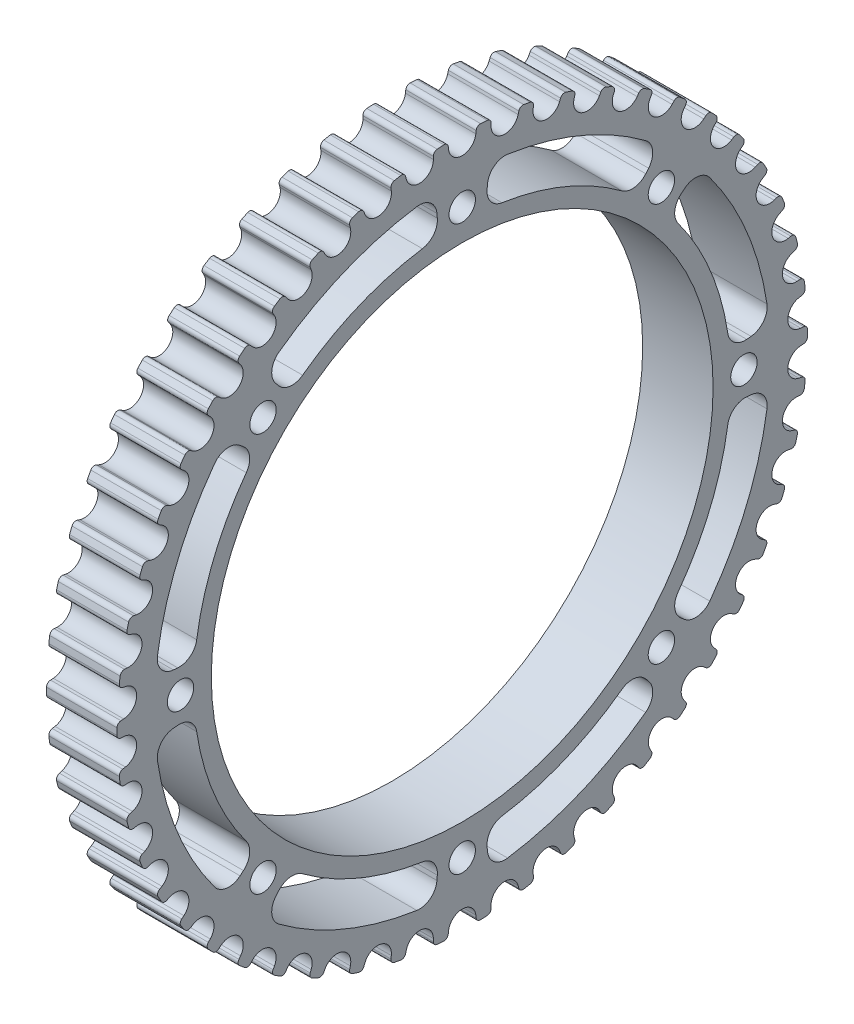
from build123d import *

# Parameters (mm, degrees)
CHAMFER_1_SIZE           = 1
SKETCH_4_W               = 5
SKETCH_4_H               = 2.299999953
CUT_EXTRUDE_1_DEPTH      = 135.926287581
FILLET_1_R               = 2
FILLET_2_R               = 2.5
SKETCH_5_R               = 4.70616
CUT_EXTRUDE_2_DEPTH      = 135.926287581
PATTERN_CIRCULAR_1_COUNT = 4
CUT_EXTRUDE_3_REACH      = 136.926
PATTERN_CIRCULAR_3_COUNT = 50
SKETCH_7_R               = 43.908876909
CUT_EXTRUDE_4_DEPTH      = 53
SKETCH_8_R               = 46.078779584
CUT_EXTRUDE_6_DEPTH      = 62
EXTRUDE_START            = -8
SKETCH_9_R               = 4.70616
EXTRUDE_1_DEPTH          = 8
SKETCH_10_R              = 45
EXTRUDE_2_DEPTH          = 2
SKETCH_11_R              = 1.5
CUT_EXTRUDE_7_DEPTH      = 10
SKETCH_12_R              = 28.5
CUT_EXTRUDE_8_DEPTH      = 10
EXTRUDE_3_DEPTH          = 4
FILLET_3_R               = 2
EXTRUDE_4_DEPTH          = 9
SKETCH_16_R              = 1.25
CUT_EXTRUDE_9_DEPTH      = 41
CUT_EXTRUDE_10_DEPTH     = 8
FILLET_4_R               = 2
SKETCH_19_W              = 50.406857466
SKETCH_19_H              = 5.280555803
SKETCH_19_H_2            = 6.899243611
SKETCH_19_W_2            = 7.452936757
SKETCH_19_H_3            = 46.072699952
CUT_EXTRUDE_11_DEPTH     = 10
CUT_EXTRUDE_START        = -2
SKETCH_18_R              = 28.5
SKETCH_18_R_2            = 18.5
CUT_EXTRUDE_2_2_DEPTH    = 2
FILLET_START             = 50
FILLET_5_DEPTH           = 10
FILLET_START_2           = 51
FILLET_5_2_DEPTH         = 10
EXTRUDE_START_2          = -2
EXTRUDE_5_OUTLINE_R      = 1.5
EXTRUDE_5_DEPTH          = 5
FILLET_6_R               = 2
EXTRUDE_6_DEPTH          = 1
SKETCH_22_R              = 59.368046871
CUT_EXTRUDE_12_DEPTH     = 12


with BuildPart() as part:
    # 草图1 → 旋转1 (revolve)
    with BuildSketch(Plane.XY, mode=Mode.PRIVATE) as revolve_1_sk:
        with BuildLine():
            Line((0, 7.8436), (0, 15.6872))
            Line((0, 15.6872), (44, 17.446730772))
            Line((44, 17.446730772), (44, 29.614869228))
            Line((44, 29.614869228), (0, 31.3744))
            Line((0, 31.3744), (0, 39.018))
            ThreePointArc((0, 39.018), (0.058578644, 39.159421356), (0.2, 39.218))
            Line((0.2, 39.218), (122.8, 39.218))
            ThreePointArc((122.8, 39.218), (122.941421356, 39.159421356), (123, 39.018))
            Line((123, 39.018), (123, 31.3744))
            Line((123, 31.3744), (79, 29.614869228))
            Line((79, 29.614869228), (79, 17.446730772))
            Line((79, 17.446730772), (123, 15.6872))
            Line((123, 15.6872), (123, 7.8436))
            Line((123, 7.8436), (0, 7.8436))
        make_face()
    revolve(revolve_1_sk.sketch.rotate(Axis((0, 0, 0), (1, 0, 0)), 90), axis=Axis((0, 0, 0), (1, 0, 0)))

    # 倒角1
    chamfer_1_edges = [part.edges().sort_by_distance(p)[0] for p in [
        (0, 0, -7.8436),
        (123, 0, -7.8436),
    ]]
    chamfer(chamfer_1_edges, length=CHAMFER_1_SIZE)

    # 草图4 → 切除-拉伸1 (cut, through all)
    with BuildSketch(Plane.ZY):
        with Locations((0, 8.584518183)):
            Rectangle(SKETCH_4_W, SKETCH_4_H)
    extrude(amount=-CUT_EXTRUDE_1_DEPTH, mode=Mode.SUBTRACT)

    # 圆角1
    fillet_1_edges = [part.edges().sort_by_distance(p)[0] for p in [
        (79, 0, -17.446730772),
        (79, 0, -29.614869228),
        (44, 0, -29.614869228),
        (44, 0, -17.446730772),
    ]]
    fillet(fillet_1_edges, radius=FILLET_1_R)

    # 圆角2
    fillet_2_edges = [part.edges().sort_by_distance(p)[0] for p in [
        (0, 0, -15.6872),
        (123, 0, -15.6872),
    ]]
    fillet(fillet_2_edges, radius=FILLET_2_R)

    # 草图5 → Cut-Extrude 2 (cut, through all)
    with BuildSketch(Plane(origin=(0, 0, 0), x_dir=(0, 0, -1), z_dir=(1, 0, 0))):
        with Locations(Location((0, 23.5308, 0), (0, 0, 120.379266324))):
            Circle(SKETCH_5_R)
    cut_extrude_2 = extrude(amount=CUT_EXTRUDE_2_DEPTH, mode=Mode.SUBTRACT)

    # 阵列(圆周)1: Cut-Extrude 2 ×4 about axis
    pattern_circular_1_axis = Axis((0, 0, 0), (1, 0, 0))
    for i in range(1, PATTERN_CIRCULAR_1_COUNT):
        add(cut_extrude_2.rotate(pattern_circular_1_axis, i * 360 / PATTERN_CIRCULAR_1_COUNT), mode=Mode.SUBTRACT)

    # 草图6 → 切除-拉伸3 (cut, up to next)
    with BuildSketch(Plane(origin=(0, 0, 0), x_dir=(0, 0, -1), z_dir=(1, 0, 0)), mode=Mode.PRIVATE) as cut_extrude_3_sk1:
        with BuildLine():
            Line((-1.586880376, 38.741509405), (-1.548371997, 38.427883824))
            ThreePointArc((-1.548371997, 38.427883824), (0, 37.058), (1.548371997, 38.427883824))
            Line((1.548371997, 38.427883824), (1.586880376, 38.741509405))
            ThreePointArc((1.586880376, 38.741509405), (1.754935187, 39.050856629), (2.088868774, 39.162330769))
            ThreePointArc((2.088868774, 39.162330769), (2.328487489, 39.148814414), (2.568019002, 39.133831941))
            Line((2.568019002, 39.133831941), (7.01809158, 75.376764653))
            ThreePointArc((7.01809158, 75.376764653), (0, 75.702775768), (-7.01809158, 75.376764653))
            Line((-7.01809158, 75.376764653), (-2.568019002, 39.133831941))
            ThreePointArc((-2.568019002, 39.133831941), (-2.328487489, 39.148814414), (-2.088868774, 39.162330769))
            ThreePointArc((-2.088868774, 39.162330769), (-1.754935187, 39.050856629), (-1.586880376, 38.741509405))
        make_face()
    cut_extrude_3_tool1 = extrude(cut_extrude_3_sk1.sketch, amount=CUT_EXTRUDE_3_REACH, mode=Mode.PRIVATE) & part.part
    cut_extrude_3 = cut_extrude_3_tool1.solids().sort_by_distance((0, 59.854012, 0))[0]
    add(cut_extrude_3, mode=Mode.SUBTRACT)

    # 阵列(圆周)3: 切除-拉伸3 ×50 about axis
    pattern_circular_3_axis = Axis((0, 0, 0), (1, 0, 0))
    for i in range(1, PATTERN_CIRCULAR_3_COUNT):
        add(cut_extrude_3.rotate(pattern_circular_3_axis, i * 360 / PATTERN_CIRCULAR_3_COUNT), mode=Mode.SUBTRACT)

    # 草图7 → 切除-拉伸4 (cut)
    with BuildSketch(Plane(origin=(123, 0, 0), x_dir=(0, 0, -1), z_dir=(1, 0, 0))):
        Circle(SKETCH_7_R)
    extrude(amount=-CUT_EXTRUDE_4_DEPTH, mode=Mode.SUBTRACT)

    # 草图8 → 切除-拉伸6 (cut)
    with BuildSketch(Plane.ZY):
        Circle(SKETCH_8_R)
    extrude(amount=-CUT_EXTRUDE_6_DEPTH, mode=Mode.SUBTRACT)

    # 草图9 → 凸台-拉伸1 (add)
    with BuildSketch(Plane(origin=(70, 0, 0), x_dir=(0, 0, -1), z_dir=(1, 0, 0)).offset(EXTRUDE_START)):
        with Locations((23.5308, 0)):
            Circle(SKETCH_9_R)
        with Locations((0, -23.5308)):
            Circle(SKETCH_9_R)
        with Locations((-23.5308, 0)):
            Circle(SKETCH_9_R)
        with Locations((0, 23.5308)):
            Circle(SKETCH_9_R)
        with BuildLine():
            Line((-2.5, 9.734518159), (-2.5, 7.434518206))
            ThreePointArc((-2.5, 7.434518206), (0, -7.8436), (2.5, 7.434518206))
            Line((2.5, 7.434518206), (2.5, 9.734518159))
            Line((2.5, 9.734518159), (-2.5, 9.734518159))
        make_face()
    extrude(amount=EXTRUDE_1_DEPTH)

    # 草图10 → 凸台-拉伸2 (add)
    with BuildSketch(Plane.ZY.offset(-62)):
        Circle(SKETCH_10_R)
    extrude(amount=EXTRUDE_2_DEPTH)

    # 草图11 → 切除-拉伸7 (cut)
    with BuildSketch(Plane.ZY.offset(-60)):
        with Locations((0, 32)):
            Circle(SKETCH_11_R)
        with Locations((22.627416998, 22.627416998)):
            Circle(SKETCH_11_R)
        with Locations((32, 0)):
            Circle(SKETCH_11_R)
        with Locations((22.627416998, -22.627416998)):
            Circle(SKETCH_11_R)
        with Locations((0, -32)):
            Circle(SKETCH_11_R)
        with Locations((-22.627416998, -22.627416998)):
            Circle(SKETCH_11_R)
        with Locations((-32, 0)):
            Circle(SKETCH_11_R)
        with Locations((-22.627416998, 22.627416998)):
            Circle(SKETCH_11_R)
    extrude(amount=-CUT_EXTRUDE_7_DEPTH, mode=Mode.SUBTRACT)

    # 草图12 → 切除-拉伸8 (cut)
    with BuildSketch(Plane.ZY.offset(-60)):
        Circle(SKETCH_12_R)
    extrude(amount=-CUT_EXTRUDE_8_DEPTH, mode=Mode.SUBTRACT)


with BuildPart() as body_2:
    # Split Bodies 1: read off the stored shape, not the designer's step
    # Split Bodies 1: the piece on the far side of the plane
    add(part.part)
    split(bisect_by=Plane.YZ.offset(62), keep=Keep.BOTTOM)

    # 草图13 → 凸台-拉伸3 (add)
    with BuildSketch(Plane.ZY.offset(-60)):
        with BuildLine():
            ThreePointArc((-5, 28.057975693), (-20.152543264, 20.152543264), (-28.057975693, 5))
            Line((-28.057975693, 5), (-19.364916731, 5))
            ThreePointArc((-19.364916731, 5), (-14.142135624, 14.142135624), (-5, 19.364916731))
            Line((-5, 19.364916731), (-5, 28.057975693))
        make_face()
        with BuildLine():
            Line((19.364916731, 5), (28.057975693, 5))
            ThreePointArc((28.057975693, 5), (20.152543264, 20.152543264), (5, 28.057975693))
            Line((5, 28.057975693), (5, 19.364916731))
            ThreePointArc((5, 19.364916731), (14.142135624, 14.142135624), (19.364916731, 5))
        make_face()
        with BuildLine():
            Line((5, -19.364916731), (5, -28.057975693))
            ThreePointArc((5, -28.057975693), (20.152543264, -20.152543264), (28.057975693, -5))
            Line((28.057975693, -5), (19.364916731, -5))
            ThreePointArc((19.364916731, -5), (14.142135624, -14.142135624), (5, -19.364916731))
        make_face()
        with BuildLine():
            ThreePointArc((-28.057975693, -5), (-20.152543264, -20.152543264), (-5, -28.057975693))
            Line((-5, -28.057975693), (-5, -19.364916731))
            ThreePointArc((-5, -19.364916731), (-14.142135624, -14.142135624), (-19.364916731, -5))
            Line((-19.364916731, -5), (-28.057975693, -5))
        make_face()
    extrude(amount=-EXTRUDE_3_DEPTH)

    # 圆角3
    fillet_3_edges = [body_2.edges().sort_by_distance(p)[0] for p in [
        (61, 28.057975693, -5),
        (61, 5, -28.057975693),
        (62, 19.364916731, -5),
        (62, 5, -19.364916731),
        (61, 5, 28.057975693),
        (61, 28.057975693, 5),
        (62, 5, 19.364916731),
        (62, 19.364916731, 5),
        (61, -28.057975693, 5),
        (61, -5, 28.057975693),
        (62, -19.364916731, 5),
        (62, -5, 19.364916731),
        (61, -28.057975693, -5),
        (62, -5, -19.364916731),
        (62, -19.364916731, -5),
        (61, -5, -28.057975693),
    ]]
    fillet(fillet_3_edges, radius=FILLET_3_R)

    # 草图15 → 凸台-拉伸4 (add)
    with BuildSketch(Plane.ZY.offset(-60)):
        Polygon((-12, 28), (-12, 16), (-8, 16), (-8, 28), (-8, 38), (8, 38), (8, 28), (8, 16), (12, 16), (12, 28), (12, 38), (12, 40), (-12, 40), (-12, 38), align=None)
        Polygon((-12, -28), (-12, -38), (-12, -40), (12, -40), (12, -38), (12, -28), (12, -16), (8, -16), (8, -28), (8, -38), (-8, -38), (-8, -28), (-8, -16), (-12, -16), align=None)
    extrude(amount=EXTRUDE_4_DEPTH)

    # 草图16 → 切除-拉伸9 (cut)
    with BuildSketch(Plane(origin=(0, 0, -12), x_dir=(-1, 0, 0), z_dir=(0, 0, -1))):
        with Locations((-54, 18.5)):
            Circle(SKETCH_16_R)
        with Locations((-54, 24.5)):
            Circle(SKETCH_16_R)
        with Locations((-54, -24.5)):
            Circle(SKETCH_16_R)
        with Locations((-54, -18.5)):
            Circle(SKETCH_16_R)
    extrude(amount=-CUT_EXTRUDE_9_DEPTH, mode=Mode.SUBTRACT)

    # 草图19 → 切除-拉伸11 (cut)
    with BuildSketch(Plane.ZY.offset(-60)):
        with Locations((0.464203518, 42.640277901)):
            Rectangle(SKETCH_19_W, SKETCH_19_H)
        with Locations((0.464203518, -43.449621806)):
            Rectangle(SKETCH_19_W, SKETCH_19_H_2)
        with Locations((-43.726468379, -0.85654393)):
            Rectangle(SKETCH_19_W_2, SKETCH_19_H_3)
        with Locations((43.726468379, -0.85654393)):
            Rectangle(SKETCH_19_W_2, SKETCH_19_H_3)
    extrude(amount=-CUT_EXTRUDE_11_DEPTH, mode=Mode.SUBTRACT)

    # 草图18 → Cut-Extrude 2 2 (cut)
    with BuildSketch(Plane(origin=(64, 0, 0), x_dir=(0, 0, -1), z_dir=(1, 0, 0)).offset(CUT_EXTRUDE_START)):
        Circle(SKETCH_18_R)
        Circle(SKETCH_18_R_2, mode=Mode.SUBTRACT)
    extrude(amount=CUT_EXTRUDE_2_2_DEPTH, mode=Mode.SUBTRACT)

    # 圆角5: read off the stored shape, not the designer's step
    # 圆角5 outline → 圆角5 (cut)
    with BuildSketch(Plane.YZ.offset(FILLET_START)):
        with BuildLine():
            Line((-16, -12), (-16, -11))
            ThreePointArc((-16, -11), (-16.292893219, -11.707106781), (-17, -12))
            Line((-17, -12), (-16, -12))
        make_face()
        with BuildLine():
            Line((-16, -8), (-17, -8))
            ThreePointArc((-17, -8), (-16.292893219, -8.292893219), (-16, -9))
            Line((-16, -9), (-16, -8))
        make_face()
        with BuildLine():
            ThreePointArc((-17, 12), (-16.292893219, 11.707106781), (-16, 11))
            Line((-16, 11), (-16, 12))
            Line((-16, 12), (-17, 12))
        make_face()
        with BuildLine():
            ThreePointArc((-16, 9), (-16.292893219, 8.292893219), (-17, 8))
            Line((-17, 8), (-16, 8))
            Line((-16, 8), (-16, 9))
        make_face()
        with BuildLine():
            ThreePointArc((17, -12), (16.292893219, -11.707106781), (16, -11))
            Line((16, -11), (16, -12))
            Line((16, -12), (17, -12))
        make_face()
        with BuildLine():
            ThreePointArc((16, -9), (16.292893219, -8.292893219), (17, -8))
            Line((17, -8), (16, -8))
            Line((16, -8), (16, -9))
        make_face()
        with BuildLine():
            ThreePointArc((17, 8), (16.292893219, 8.292893219), (16, 9))
            Line((16, 9), (16, 8))
            Line((16, 8), (17, 8))
        make_face()
        with BuildLine():
            ThreePointArc((16, 11), (16.292893219, 11.707106781), (17, 12))
            Line((17, 12), (16, 12))
            Line((16, 12), (16, 11))
        make_face()
    extrude(amount=FILLET_5_DEPTH, mode=Mode.SUBTRACT)

    # Fillet 5 2 outline → Fillet 5 2 (add)
    with BuildSketch(Plane.YZ.offset(FILLET_START_2)):
        with BuildLine():
            Line((-38, 8), (-38, 7))
            ThreePointArc((-38, 7), (-37.707106781, 7.707106781), (-37, 8))
            Line((-37, 8), (-38, 8))
        make_face()
        with BuildLine():
            ThreePointArc((-37, -8), (-37.707106781, -7.707106781), (-38, -7))
            Line((-38, -7), (-38, -8))
            Line((-38, -8), (-37, -8))
        make_face()
        with BuildLine():
            Line((38, -8), (38, -7))
            ThreePointArc((38, -7), (37.707106781, -7.707106781), (37, -8))
            Line((37, -8), (38, -8))
        make_face()
        with BuildLine():
            Line((38, 8), (37, 8))
            ThreePointArc((37, 8), (37.707106781, 7.707106781), (38, 7))
            Line((38, 7), (38, 8))
        make_face()
    extrude(amount=FILLET_5_2_DEPTH)

    # 凸台-拉伸5: read off the stored shape, not the designer's step
    # 凸台-拉伸5 outline → 凸台-拉伸5 (add)
    # profile 1 of 2: a face of its own
    with BuildSketch(Plane.ZY.offset(-60).offset(EXTRUDE_START_2)):
        with BuildLine():
            ThreePointArc((-8, 18.33030278), (0, 20), (8, 18.33030278))
            Line((8, 18.33030278), (8, 37))
            ThreePointArc((8, 37), (7.707106781, 37.707106781), (7, 38))
            Line((7, 38), (-7, 38))
            ThreePointArc((-7, 38), (-7.707106781, 37.707106781), (-8, 37))
            Line((-8, 37), (-8, 18.33030278))
        make_face()
        with Locations((0, 32)):
            Circle(EXTRUDE_5_OUTLINE_R, mode=Mode.SUBTRACT)
    # profile 2 of 2: a face of its own
    with BuildSketch(Plane.ZY.offset(-60).offset(EXTRUDE_START_2)):
        with BuildLine():
            ThreePointArc((8, -18.33030278), (0, -20), (-8, -18.33030278))
            Line((-8, -18.33030278), (-8, -37))
            ThreePointArc((-8, -37), (-7.707106781, -37.707106781), (-7, -38))
            Line((-7, -38), (7, -38))
            ThreePointArc((7, -38), (7.707106781, -37.707106781), (8, -37))
            Line((8, -37), (8, -18.33030278))
        make_face()
    extrude(amount=EXTRUDE_5_DEPTH)

    # 圆角6
    # the kernel refuses this fillet: 2 mm, written as the material it adds along each edge
    with BuildSketch(Plane(origin=(60, -18.33030278, 8), x_dir=(0, 0.9999999993502281, 3.6049189378695776e-05), z_dir=(-1, 0, 0)), Plane(origin=(60, 18.33030278, -8), x_dir=(0, -0.9999999993502281, -3.6049189378695776e-05), z_dir=(-1, 0, 0))) as fillet_6_piece_1:
        with BuildLine():
            CenterArc((1.359719179, 1.999904086), FILLET_6_R, 199.473775417, 69.965092231)
            Line((-0.525869176, 1.333153342), (-0.714428011, 1.266478267))
            ThreePointArc((-0.714428011, 1.266478267), (-0.460928425, 0.588476986), (-0.183300144, -0.080006608))
            Line((-0.183300144, -0.080006608), (7.21e-06, -0.2))
            ThreePointArc((7.21e-06, -0.2), (1.330309989, -0.199952044), (1.338173588, -0.199990409))
            Line((1.338173588, -0.199990409), (1.340132278, 0))
        make_face()
    extrude(amount=3)
    with BuildSketch(Plane(origin=(60, -18.33030278, -8), x_dir=(0, -0.3669062573147072, 0.9302579203335566), z_dir=(-1, 0, 0))) as fillet_6_piece_2:
        with BuildLine():
            CenterArc((1.36146509, 1.99871594), FILLET_6_R, 202.088142032, 69.965092231)
            Line((-0.49174786, 1.24665094), (-0.677069155, 1.17144444))
            ThreePointArc((-0.677069155, 1.17144444), (-0.674147998, 1.164143446), (-0.186051584, -0.073381251))
            Line((-0.186051584, -0.073381251), (-0.007165606, -0.199871594))
            ThreePointArc((-0.007165606, -0.199871594), (0.716560574, -0.212840598), (1.440286753, -0.199871594))
            Line((1.440286753, -0.199871594), (1.433121147, 0))
        make_face()
    extrude(amount=3)
    with BuildSketch(Plane(origin=(60, 18.33030278, 8), x_dir=(0, -0.9999999993502281, 3.6049189378695776e-05), z_dir=(-1, 0, 0))) as fillet_6_piece_3:
        with BuildLine():
            CenterArc((1.359719179, -1.999904086), FILLET_6_R, 90.561132352, 69.965092231)
            Line((-0.525869176, -1.333153342), (-0.714428011, -1.266478267))
            ThreePointArc((-0.714428011, -1.266478267), (-0.460928425, -0.588476986), (-0.183300144, 0.080006608))
            Line((-0.183300144, 0.080006608), (7.21e-06, 0.2))
            ThreePointArc((7.21e-06, 0.2), (1.330309989, 0.199952044), (1.338173588, 0.199990409))
            Line((1.338173588, 0.199990409), (1.340132278, 0))
        make_face()
    extrude(amount=3)
    # the kernel refuses this fillet: 2 mm, written as the material it takes off along each edge
    with BuildSketch(Plane(origin=(58.744491905, 40, 20.615528128), x_dir=(0, -0.46307574697476006, 0.8863187082329741), z_dir=(1, 0, 0)), Plane(origin=(58.744491905, 20.615528128, -40), x_dir=(0, 0.8863187082329769, 0.46307574697475473), z_dir=(1, 0, 0))) as fillet_6_2_piece_1:
        with BuildLine():
            CenterArc((0.491043166, 1.999968863), FILLET_6_R, 242.414241379, 27.905472791)
            Line((-0.435108328, 0.227331446), (0, 0))
            ThreePointArc((0, 0), (0.251101619, -0.000700583), (0.502203238, 0))
        make_face()
    extrude(amount=4.51101619, mode=Mode.SUBTRACT)
    with BuildSketch(Plane(origin=(58.744491905, 40, -20.615528128), x_dir=(0, 0, 1), z_dir=(1, 0, 0)), Plane(origin=(58.744491905, -40, 20.615528128), x_dir=(0, 0, -1), z_dir=(1, 0, 0)), Plane(origin=(58.744491905, 20.615528128, 40), x_dir=(0, -1, 0), z_dir=(1, 0, 0))) as fillet_6_2_piece_2:
        with BuildLine():
            CenterArc((0.490916331, 2), FILLET_6_R, 242.094527209, 27.905472791)
            ThreePointArc((-0.445112125, 0.23255814), (-0.222880486, 0.11565813), (0, 0))
            Line((0, 0), (0.490916331, 0))
        make_face()
    extrude(amount=4.51101619, mode=Mode.SUBTRACT)
    with BuildSketch(Plane(origin=(58.744491905, -20.615528128, -40), x_dir=(0, -0.8863187082329741, 0.46307574697476006), z_dir=(1, 0, 0))) as fillet_6_2_piece_3:
        with BuildLine():
            CenterArc((0.491043166, -1.999968863), FILLET_6_R, 89.68028583, 27.905472791)
            Line((-0.435108328, -0.227331446), (0, 0))
            ThreePointArc((0, 0), (0.251101619, 0.000700583), (0.502203238, 0))
        make_face()
    extrude(amount=4.51101619, mode=Mode.SUBTRACT)
    with BuildSketch(Plane(origin=(58.744491905, -40, -20.615528128), x_dir=(0, 0, 1), z_dir=(1, 0, 0)), Plane(origin=(58.744491905, -20.615528128, 40), x_dir=(0, 1, 0), z_dir=(1, 0, 0))) as fillet_6_2_piece_4:
        with BuildLine():
            CenterArc((0.490916331, -2), FILLET_6_R, 90, 27.905472791)
            ThreePointArc((-0.445112125, -0.23255814), (-0.222880486, -0.11565813), (0, 0))
            Line((0, 0), (0.490916331, 0))
        make_face()
    extrude(amount=4.51101619, mode=Mode.SUBTRACT)

    # 草图21 → 凸台-拉伸6 (add)
    with BuildSketch(Plane.ZY.offset(-51)):
        with BuildLine():
            Line((12, -40), (12, -17))
            ThreePointArc((12, -17), (11.707106781, -16.292893219), (11, -16))
            Line((11, -16), (9, -16))
            ThreePointArc((9, -16), (8.292893219, -16.292893219), (8, -17))
            Line((8, -17), (8, -37))
            ThreePointArc((8, -37), (7.707106781, -37.707106781), (7, -38))
            Line((7, -38), (-7, -38))
            ThreePointArc((-7, -38), (-7.707106781, -37.707106781), (-8, -37))
            Line((-8, -37), (-8, -17))
            ThreePointArc((-8, -17), (-8.292893219, -16.292893219), (-9, -16))
            Line((-9, -16), (-11, -16))
            ThreePointArc((-11, -16), (-11.707106781, -16.292893219), (-12, -17))
            Line((-12, -17), (-12, -40))
            Line((-12, -40), (12, -40))
        make_face()
        with BuildLine():
            Line((9, 16), (11, 16))
            ThreePointArc((11, 16), (11.707106781, 16.292893219), (12, 17))
            Line((12, 17), (12, 40))
            Line((12, 40), (-12, 40))
            Line((-12, 40), (-12, 17))
            ThreePointArc((-12, 17), (-11.707106781, 16.292893219), (-11, 16))
            Line((-11, 16), (-9, 16))
            ThreePointArc((-9, 16), (-8.292893219, 16.292893219), (-8, 17))
            Line((-8, 17), (-8, 37))
            ThreePointArc((-8, 37), (-7.707106781, 37.707106781), (-7, 38))
            Line((-7, 38), (7, 38))
            ThreePointArc((7, 38), (7.707106781, 37.707106781), (8, 37))
            Line((8, 37), (8, 17))
            ThreePointArc((8, 17), (8.292893219, 16.292893219), (9, 16))
        make_face()
    extrude(amount=EXTRUDE_6_DEPTH)

    # 草图22 → 切除-拉伸12 (cut)
    with BuildSketch(Plane.ZY.offset(-50)):
        Circle(SKETCH_22_R)
    extrude(amount=-CUT_EXTRUDE_12_DEPTH, mode=Mode.SUBTRACT)


with BuildPart() as part_1:
    add(part.part)

    # Split Bodies 1
    split(bisect_by=Plane.YZ.offset(62), keep=Keep.TOP)

    # 草图17 → 切除-拉伸10 (cut)
    with BuildSketch(Plane(origin=(70, 0, 0), x_dir=(0, 0, -1), z_dir=(1, 0, 0))):
        with BuildLine():
            ThreePointArc((23.364355515, 19.605022095), (28.178325742, 11.671844687), (30.383938292, 2.658250154))
            Line((30.383938292, 2.658250154), (34.866814433, 3.050450996))
            ThreePointArc((34.866814433, 3.050450996), (32.335783638, 13.393920133), (26.811555509, 22.497566339))
            Line((26.811555509, 22.497566339), (23.364355515, 19.605022095))
        make_face()
        with BuildLine():
            ThreePointArc((30.383938292, -2.658250154), (28.178325742, -11.671844687), (23.364355515, -19.605022095))
            Line((23.364355515, -19.605022095), (26.811555509, -22.497566339))
            ThreePointArc((26.811555509, -22.497566339), (32.335783638, -13.393920133), (34.866814433, -3.050450996))
            Line((34.866814433, -3.050450996), (30.383938292, -2.658250154))
        make_face()
        with BuildLine():
            ThreePointArc((19.605022095, -23.364355515), (11.671844687, -28.178325742), (2.658250154, -30.383938292))
            Line((2.658250154, -30.383938292), (3.050450996, -34.866814433))
            ThreePointArc((3.050450996, -34.866814433), (13.393920133, -32.335783638), (22.497566339, -26.811555509))
            Line((22.497566339, -26.811555509), (19.605022095, -23.364355515))
        make_face()
        with BuildLine():
            ThreePointArc((-2.658250154, -30.383938292), (-11.671844687, -28.178325742), (-19.605022095, -23.364355515))
            Line((-19.605022095, -23.364355515), (-22.497566339, -26.811555509))
            ThreePointArc((-22.497566339, -26.811555509), (-13.393920133, -32.335783638), (-3.050450996, -34.866814433))
            Line((-3.050450996, -34.866814433), (-2.658250154, -30.383938292))
        make_face()
        with BuildLine():
            ThreePointArc((-23.364355515, -19.605022095), (-28.178325742, -11.671844687), (-30.383938292, -2.658250154))
            Line((-30.383938292, -2.658250154), (-34.866814433, -3.050450996))
            ThreePointArc((-34.866814433, -3.050450996), (-32.335783638, -13.393920133), (-26.811555509, -22.497566339))
            Line((-26.811555509, -22.497566339), (-23.364355515, -19.605022095))
        make_face()
        with BuildLine():
            ThreePointArc((-30.383938292, 2.658250154), (-28.178325742, 11.671844687), (-23.364355515, 19.605022095))
            Line((-23.364355515, 19.605022095), (-26.811555509, 22.497566339))
            ThreePointArc((-26.811555509, 22.497566339), (-32.335783638, 13.393920133), (-34.866814433, 3.050450996))
            Line((-34.866814433, 3.050450996), (-30.383938292, 2.658250154))
        make_face()
        with BuildLine():
            ThreePointArc((-19.605022095, 23.364355515), (-11.671844687, 28.178325742), (-2.658250154, 30.383938292))
            Line((-2.658250154, 30.383938292), (-3.050450996, 34.866814433))
            ThreePointArc((-3.050450996, 34.866814433), (-13.393920133, 32.335783638), (-22.497566339, 26.811555509))
            Line((-22.497566339, 26.811555509), (-19.605022095, 23.364355515))
        make_face()
        with BuildLine():
            ThreePointArc((2.658250154, 30.383938292), (11.671844687, 28.178325742), (19.605022095, 23.364355515))
            Line((19.605022095, 23.364355515), (22.497566339, 26.811555509))
            ThreePointArc((22.497566339, 26.811555509), (13.393920133, 32.335783638), (3.050450996, 34.866814433))
            Line((3.050450996, 34.866814433), (2.658250154, 30.383938292))
        make_face()
    extrude(amount=-CUT_EXTRUDE_10_DEPTH, mode=Mode.SUBTRACT)

    # 圆角4
    fillet_4_edges = [part_1.edges().sort_by_distance(p)[0] for p in [
        (66, 23.364355515, -19.605022095),
        (66, 30.383938292, -2.658250154),
        (66, 34.866814433, -3.050450996),
        (66, 26.811555509, -22.497566339),
        (66, 34.866814433, 3.050450996),
        (66, 30.383938292, 2.658250154),
        (66, 23.364355515, 19.605022095),
        (66, 26.811555509, 22.497566339),
        (66, 19.605022095, 23.364355515),
        (66, 2.658250154, 30.383938292),
        (66, 3.050450996, 34.866814433),
        (66, 22.497566339, 26.811555509),
        (66, -2.658250154, 30.383938292),
        (66, -19.605022095, 23.364355515),
        (66, -22.497566339, 26.811555509),
        (66, -3.050450996, 34.866814433),
        (66, -23.364355515, 19.605022095),
        (66, -30.383938292, 2.658250154),
        (66, -34.866814433, 3.050450996),
        (66, -26.811555509, 22.497566339),
        (66, -30.383938292, -2.658250154),
        (66, -23.364355515, -19.605022095),
        (66, -26.811555509, -22.497566339),
        (66, -34.866814433, -3.050450996),
        (66, -19.605022095, -23.364355515),
        (66, -2.658250154, -30.383938292),
        (66, -3.050450996, -34.866814433),
        (66, -22.497566339, -26.811555509),
        (66, 2.658250154, -30.383938292),
        (66, 19.605022095, -23.364355515),
        (66, 22.497566339, -26.811555509),
        (66, 3.050450996, -34.866814433),
    ]]
    fillet(fillet_4_edges, radius=FILLET_4_R)


solid = part_1.part
